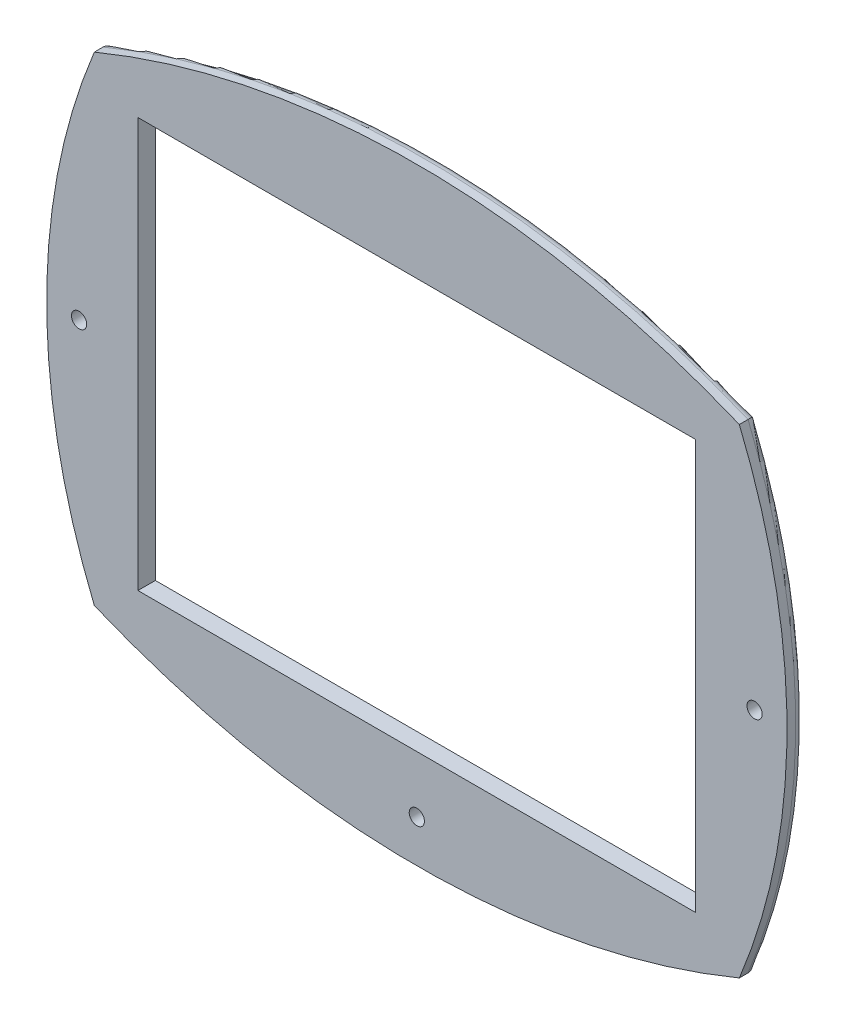
from build123d import *

# Parameters (mm, degrees)
SKETCH1_W           = 64
SKETCH1_H           = 47
BOSS_EXTRUDE1_DEPTH = 2
FILLET1_R           = 1
SKETCH2_R           = 0.875
CUT_EXTRUDE1_DEPTH  = 55.981008251


with BuildPart() as part:
    # Sketch1 → Boss-Extrude1 (new body)
    with BuildSketch(Plane.XY):
        with BuildLine():
            ThreePointArc((37, 27.5), (0, 34.859757593), (-37, 27.5))
            ThreePointArc((-37, 27.5), (-42.470090103, 0), (-37, -27.5))
            ThreePointArc((-37, -27.5), (0, -34.859757593), (37, -27.5))
            ThreePointArc((37, -27.5), (42.470090103, 0), (37, 27.5))
        make_face()
        Rectangle(SKETCH1_W, SKETCH1_H, mode=Mode.SUBTRACT)
    extrude(amount=BOSS_EXTRUDE1_DEPTH)

    # Fillet1
    fillet1_edges = [part.edges().sort_by_distance(p)[0] for p in [
        (-42.470090103, 0, 0),
        (0, -34.859757593, 0),
        (42.470090103, 0, 0),
        (0, 34.859757593, 0),
    ]]
    fillet(fillet1_edges, radius=FILLET1_R)

    # Sketch2 → Cut-Extrude1 (cut, through all)
    with BuildSketch(Plane(origin=(0, 0, 0), x_dir=(-1, 0, 0), z_dir=(0, 0, -1))):
        with Locations((-38.75, 0)):
            Circle(SKETCH2_R)
        with Locations((0, -30)):
            Circle(SKETCH2_R)
        with Locations((38.75, 0)):
            Circle(SKETCH2_R)
    extrude(amount=-CUT_EXTRUDE1_DEPTH, mode=Mode.SUBTRACT)


solid = part.part
